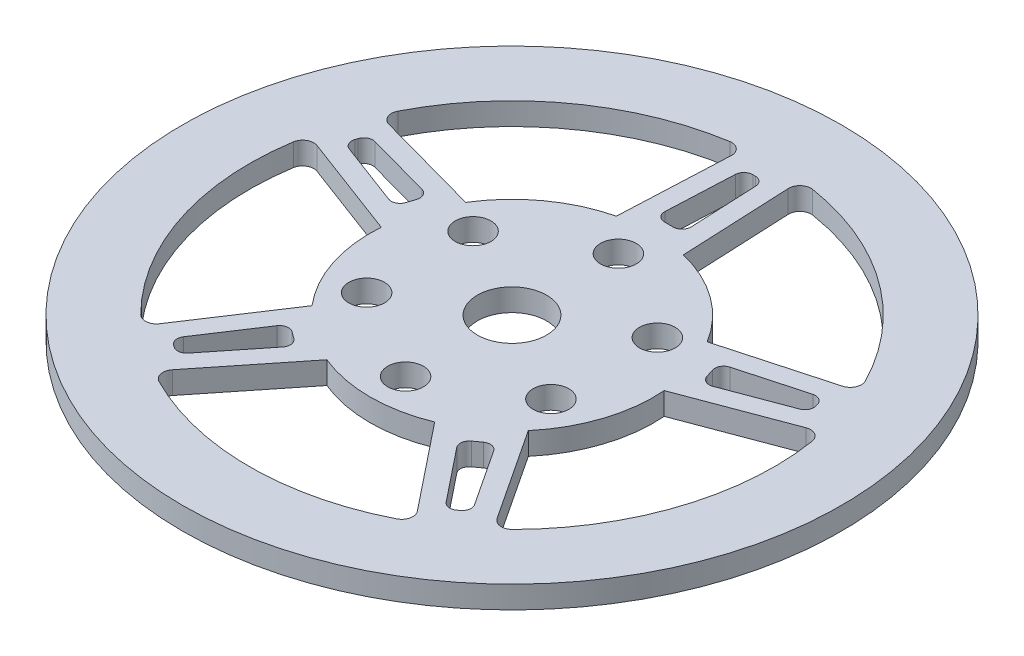
from build123d import *

# Parameters (mm, degrees)
SKETCH1_R           = 29.5
SKETCH1_R_2         = 1.6
SKETCH1_R_3         = 3.1
BOSS_EXTRUDE1_DEPTH = 2
FILLET2_R           = 1
FILLET3_R           = 0.8


with BuildPart() as part:
    # Sketch1 → Boss-Extrude1 (new body)
    with BuildSketch(Plane(origin=(0, 0, 0), x_dir=(1, 0, 0), z_dir=(0, 1, 0))):
        Circle(SKETCH1_R)
        with Locations((0, 9.525)):
            Circle(SKETCH1_R_2, mode=Mode.SUBTRACT)
        with Locations((-8.248891971, 4.7625)):
            Circle(SKETCH1_R_2, mode=Mode.SUBTRACT)
        with Locations((-8.248891971, -4.7625)):
            Circle(SKETCH1_R_2, mode=Mode.SUBTRACT)
        with Locations((0, -9.525)):
            Circle(SKETCH1_R_2, mode=Mode.SUBTRACT)
        with Locations((8.248891971, 4.7625)):
            Circle(SKETCH1_R_2, mode=Mode.SUBTRACT)
        Circle(SKETCH1_R_3, mode=Mode.SUBTRACT)
        with Locations((8.248891971, -4.7625)):
            Circle(SKETCH1_R_2, mode=Mode.SUBTRACT)
        with BuildLine():
            Line((-2.5, 23.366642891), (-3, 12.340583455))
            ThreePointArc((-3, 12.340583455), (-7.464872704, 10.274515829), (-10.809541326, 6.666619557))
            Line((-10.809541326, 6.666619557), (-21.4504555, 9.598331046))
            ThreePointArc((-21.4504555, 9.598331046), (-13.812953429, 19.011899368), (-2.5, 23.366642891))
        make_face(mode=Mode.SUBTRACT)
        with BuildLine():
            Line((2.5, 23.366642891), (3, 12.340583455))
            ThreePointArc((3, 12.340583455), (7.464872704, 10.274515829), (10.809541326, 6.666619557))
            Line((10.809541326, 6.666619557), (21.4504555, 9.598331046))
            ThreePointArc((21.4504555, 9.598331046), (13.812953429, 19.011899368), (2.5, 23.366642891))
        make_face(mode=Mode.SUBTRACT)
        Polygon((-0.875343089, 21.666642891), (0.875343089, 21.666642891), (1.221162893, 14.040583455), (-1.221162893, 14.040583455), align=None, mode=Mode.SUBTRACT)
        Polygon((12.9760283, 5.500173825), (20.335706018, 7.527861613), (20.876697798, 5.862860116), (13.730748474, 3.177383971), align=None, mode=Mode.SUBTRACT)
        with BuildLine():
            Line((22.995540471, 4.843048464), (12.663643293, 0.960280459))
            ThreePointArc((12.663643293, 0.960280459), (12.078417757, -3.924515829), (9.680663942, -8.220385978))
            Line((9.680663942, -8.220385978), (15.757110573, -17.43454807))
            ThreePointArc((15.757110573, -17.43454807), (22.349828133, -7.261899368), (22.995540471, 4.843048464))
        make_face(mode=Mode.SUBTRACT)
        Polygon((9.240789422, -10.641289087), (13.443500593, -17.014168552), (12.027165723, -18.043196068), (7.264906355, -12.076852165), align=None, mode=Mode.SUBTRACT)
        with BuildLine():
            Line((11.712025601, -20.373474331), (4.826561976, -11.747097492))
            ThreePointArc((4.826561976, -11.747097492), (0, -12.7), (-4.826561976, -11.747097492))
            Line((-4.826561976, -11.747097492), (-11.712025601, -20.373474331))
            ThreePointArc((-11.712025601, -20.373474331), (0, -23.5), (11.712025601, -20.373474331))
        make_face(mode=Mode.SUBTRACT)
        Polygon((-7.264906355, -12.076852165), (-12.027165723, -18.043196068), (-13.443500593, -17.014168552), (-9.240789422, -10.641289087), align=None, mode=Mode.SUBTRACT)
        with BuildLine():
            Line((-15.757110573, -17.43454807), (-9.680663942, -8.220385978))
            ThreePointArc((-9.680663942, -8.220385978), (-12.078417757, -3.924515829), (-12.663643293, 0.960280459))
            Line((-12.663643293, 0.960280459), (-22.995540471, 4.843048464))
            ThreePointArc((-22.995540471, 4.843048464), (-22.349828133, -7.261899368), (-15.757110573, -17.43454807))
        make_face(mode=Mode.SUBTRACT)
        Polygon((-13.730748474, 3.177383971), (-20.876697798, 5.862860116), (-20.335706018, 7.527861613), (-12.9760283, 5.500173825), align=None, mode=Mode.SUBTRACT)
    extrude(amount=BOSS_EXTRUDE1_DEPTH)

    # Fillet2
    fillet2_edges = [part.edges().sort_by_distance(p)[0] for p in [
        (-15.757110573, 1, 17.43454807),
        (-11.712025601, 1, 20.373474331),
        (11.712025601, 1, 20.373474331),
        (15.757110573, 1, 17.43454807),
        (22.995540471, 1, -4.843048464),
        (21.4504555, 1, -9.598331046),
        (2.5, 1, -23.366642891),
        (-2.5, 1, -23.366642891),
        (-22.995540471, 1, -4.843048464),
        (-21.4504555, 1, -9.598331046),
    ]]
    fillet(fillet2_edges, radius=FILLET2_R)

    # Fillet3
    fillet3_edges = [part.edges().sort_by_distance(p)[0] for p in [
        (-20.876697798, 1, -5.862860116),
        (-20.335706018, 1, -7.527861613),
        (-12.9760283, 1, -5.500173825),
        (-13.730748474, 1, -3.177383971),
        (-12.027165723, 1, 18.043196068),
        (-13.443500593, 1, 17.014168552),
        (-9.240789422, 1, 10.641289087),
        (-7.264906355, 1, 12.076852165),
        (13.443500593, 1, 17.014168552),
        (12.027165723, 1, 18.043196068),
        (7.264906355, 1, 12.076852165),
        (9.240789422, 1, 10.641289087),
        (12.9760283, 1, -5.500173825),
        (20.335706018, 1, -7.527861613),
        (20.876697798, 1, -5.862860116),
        (13.730748474, 1, -3.177383971),
        (-0.875343089, 1, -21.666642891),
        (0.875343089, 1, -21.666642891),
        (-1.221162893, 1, -14.040583455),
        (1.221162893, 1, -14.040583455),
    ]]
    fillet(fillet3_edges, radius=FILLET3_R)


solid = part.part
